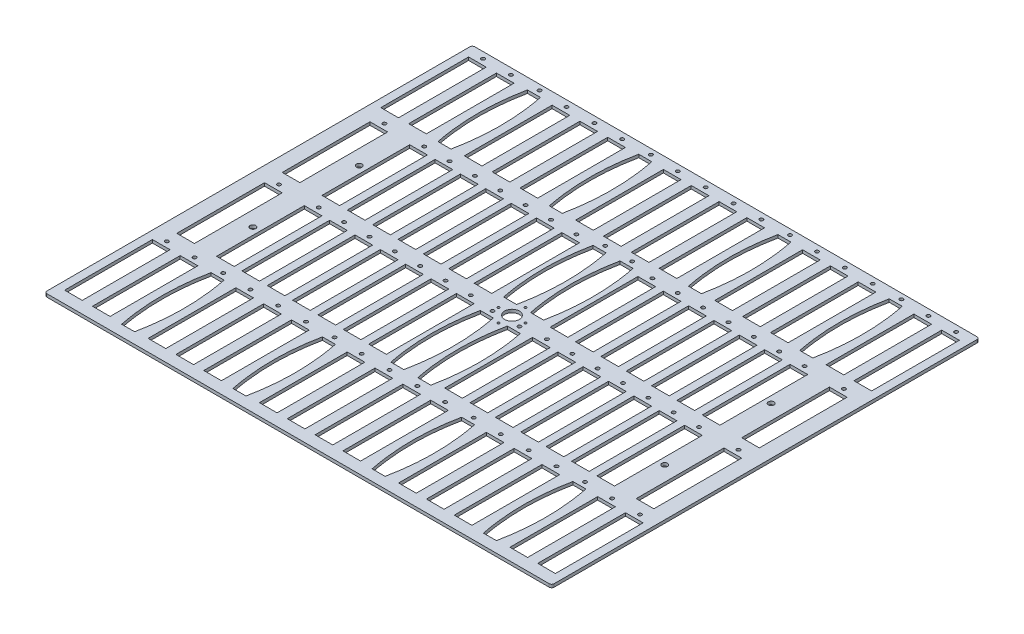
from build123d import *

# Parameters (mm, degrees)
SKETCH1_W                  = 525.4625
SKETCH1_H                  = 443.27572
BOSS_EXTRUDE1_DEPTH        = 3.175
SKETCH2_R                  = 7.62
CUT_EXTRUDE1_DEPTH         = 344.745736464
F_2_CLEARANCE_HOLE1_D      = 2.4384
F_1_0_228_DIAMETER_HOLE1_D = 5.7912
SKETCH5_R                  = 1.8288
SKETCH5_W                  = 18.288
SKETCH5_H                  = 90.932
CUT_EXTRUDE3_DEPTH         = 3.175
F_6_CLEARANCE_HOLE2_D      = 3.6576
SKETCH11_R                 = 1.8288
SKETCH11_W                 = 18.288
SKETCH11_H                 = 90.932
CUT_EXTRUDE5_DEPTH         = 3.175
SKETCH12_R                 = 1.8288
SKETCH12_W                 = 18.288
SKETCH12_H                 = 90.932
CUT_EXTRUDE6_DEPTH         = 3.175
FILLET1_R                  = 2.54


with BuildPart() as part:
    # Sketch1 → Boss-Extrude1 (new body)
    with BuildSketch(Plane(origin=(0, 0, 0), x_dir=(1, 0, 0), z_dir=(0, 1, 0))):
        Rectangle(SKETCH1_W, SKETCH1_H)
    extrude(amount=BOSS_EXTRUDE1_DEPTH)

    # Sketch2 → Cut-Extrude1 (cut, through all)
    with BuildSketch(Plane(origin=(0, 3.175, 0), x_dir=(1, 0, 0), z_dir=(0, 1, 0))):
        Circle(SKETCH2_R)
    extrude(amount=-CUT_EXTRUDE1_DEPTH, mode=Mode.SUBTRACT)

    # #2 Clearance Hole1 (through all)
    with Locations(Plane(origin=(0, 3.175, 0), x_dir=(1, 0, 0), z_dir=(0, 1, 0))):
        with Locations((0, 0), (0, 13.97), (13.97, 0), (0, -13.97), (-13.97, 0)):
            Hole(F_2_CLEARANCE_HOLE1_D / 2)

    # #1 (0.228) Diameter Hole1 (through all)
    with Locations(Plane(origin=(0, 3.175, 0), x_dir=(1, 0, 0), z_dir=(0, 1, 0))):
        with Locations((213.36, 55.1010709), (-213.36, -55.1010709), (-213.36, 55.1010709), (213.36, -55.1010709)):
            Hole(F_1_0_228_DIAMETER_HOLE1_D / 2)

    # Sketch5 → Cut-Extrude3 (cut)
    with BuildSketch(Plane(origin=(0, 3.175, 0), x_dir=(1, 0, 0), z_dir=(0, 1, 0))):
        with Locations((-245.13667, 215.13546)):
            Circle(SKETCH5_R)
        with Locations((-245.13667, -112.52708)):
            Circle(SKETCH5_R)
        with Locations((-216.29751, 215.13546)):
            Circle(SKETCH5_R)
        with Locations((-216.29751, -112.52708)):
            Circle(SKETCH5_R)
        with Locations((-187.457503333, 216.02446)):
            Circle(SKETCH5_R)
        with Locations((-72.09917, 216.02446)):
            Circle(SKETCH5_R)
        with Locations((-158.61919, 215.13546)):
            Circle(SKETCH5_R)
        with Locations((-158.61919, -112.52708)):
            Circle(SKETCH5_R)
        with Locations((-129.78003, 215.13546)):
            Circle(SKETCH5_R)
        with Locations((-129.78003, -112.52708)):
            Circle(SKETCH5_R)
        with Locations((-100.94087, 215.13546)):
            Circle(SKETCH5_R)
        with Locations((-100.94087, -112.52708)):
            Circle(SKETCH5_R)
        with Locations((72.098746667, 216.02446)):
            Circle(SKETCH5_R)
        with Locations((187.45708, 216.02446)):
            Circle(SKETCH5_R)
        with Locations((-43.26255, 215.13546)):
            Circle(SKETCH5_R)
        with Locations((-43.26255, -112.52708)):
            Circle(SKETCH5_R)
        with Locations((-14.42339, 215.13546)):
            Circle(SKETCH5_R)
        with Locations((-14.42339, -112.52708)):
            Circle(SKETCH5_R)
        with Locations((14.41577, 215.13546)):
            Circle(SKETCH5_R)
        with Locations((14.41577, -112.52708)):
            Circle(SKETCH5_R)
        with Locations((43.25493, 215.13546)):
            Circle(SKETCH5_R)
        with Locations((43.25493, -112.52708)):
            Circle(SKETCH5_R)
        with Locations((-187.457503333, -111.78794)):
            Circle(SKETCH5_R)
        with Locations((-72.09917, -111.78794)):
            Circle(SKETCH5_R)
        with Locations((100.93325, 215.13546)):
            Circle(SKETCH5_R)
        with Locations((100.93325, -112.52708)):
            Circle(SKETCH5_R)
        with Locations((129.77241, 215.13546)):
            Circle(SKETCH5_R)
        with Locations((129.77241, -112.52708)):
            Circle(SKETCH5_R)
        with Locations((158.61157, 215.13546)):
            Circle(SKETCH5_R)
        with Locations((158.61157, -112.52708)):
            Circle(SKETCH5_R)
        with Locations((187.45708, -111.78794)):
            Circle(SKETCH5_R)
        with Locations((72.098746667, -111.78794)):
            Circle(SKETCH5_R)
        with Locations((216.28989, 215.13546)):
            Circle(SKETCH5_R)
        with Locations((216.28989, -112.52708)):
            Circle(SKETCH5_R)
        with Locations((245.12905, 215.13546)):
            Circle(SKETCH5_R)
        with Locations((245.12905, -112.52708)):
            Circle(SKETCH5_R)
        with Locations((-216.29751, 163.82746)):
            Rectangle(SKETCH5_W, SKETCH5_H)
        with Locations((-245.13667, 163.82746)):
            Rectangle(SKETCH5_W, SKETCH5_H)
        with Locations((-245.13667, -163.83508)):
            Rectangle(SKETCH5_W, SKETCH5_H)
        with Locations((-216.29751, -163.83508)):
            Rectangle(SKETCH5_W, SKETCH5_H)
        with BuildLine():
            Line((-194.188503333, 210.18246), (-180.726503333, 210.18246))
            add(Edge.make_bspline(
                [(-180.726503333, 210.18246), (-171.328503333, 163.82746), (-180.726503333, 117.47246)],
                knots=[0, 0, 0, 1, 1, 1], degree=2))
            Line((-180.726503333, 117.47246), (-194.188503333, 117.47246))
            add(Edge.make_bspline(
                [(-194.188503333, 210.18246), (-203.586503333, 163.82746), (-194.188503333, 117.47246)],
                knots=[0, 0, 0, 1, 1, 1], degree=2))
        make_face()
        with BuildLine():
            Line((-78.83017, 210.18246), (-65.36817, 210.18246))
            add(Edge.make_bspline(
                [(-65.36817, 210.18246), (-55.97017, 163.82746), (-65.36817, 117.47246)],
                knots=[0, 0, 0, 1, 1, 1], degree=2))
            Line((-65.36817, 117.47246), (-78.83017, 117.47246))
            add(Edge.make_bspline(
                [(-78.83017, 210.18246), (-88.22817, 163.82746), (-78.83017, 117.47246)],
                knots=[0, 0, 0, 1, 1, 1], degree=2))
        make_face()
        with Locations((-158.61919, 163.82746)):
            Rectangle(SKETCH5_W, SKETCH5_H)
        with Locations((-158.61919, -163.83508)):
            Rectangle(SKETCH5_W, SKETCH5_H)
        with Locations((-129.78003, 163.82746)):
            Rectangle(SKETCH5_W, SKETCH5_H)
        with Locations((-129.78003, -163.83508)):
            Rectangle(SKETCH5_W, SKETCH5_H)
        with Locations((-100.94087, 163.82746)):
            Rectangle(SKETCH5_W, SKETCH5_H)
        with Locations((-100.94087, -163.83508)):
            Rectangle(SKETCH5_W, SKETCH5_H)
        with BuildLine():
            Line((65.367746667, 210.18246), (78.829746667, 210.18246))
            add(Edge.make_bspline(
                [(78.829746667, 210.18246), (88.227746667, 163.82746), (78.829746667, 117.47246)],
                knots=[0, 0, 0, 1, 1, 1], degree=2))
            Line((78.829746667, 117.47246), (65.367746667, 117.47246))
            add(Edge.make_bspline(
                [(65.367746667, 210.18246), (55.969746667, 163.82746), (65.367746667, 117.47246)],
                knots=[0, 0, 0, 1, 1, 1], degree=2))
        make_face()
        with BuildLine():
            Line((180.72608, 210.18246), (194.18808, 210.18246))
            add(Edge.make_bspline(
                [(194.18808, 210.18246), (203.58608, 163.82746), (194.18808, 117.47246)],
                knots=[0, 0, 0, 1, 1, 1], degree=2))
            Line((194.18808, 117.47246), (180.72608, 117.47246))
            add(Edge.make_bspline(
                [(180.72608, 210.18246), (171.32808, 163.82746), (180.72608, 117.47246)],
                knots=[0, 0, 0, 1, 1, 1], degree=2))
        make_face()
        with BuildLine():
            Line((-194.188503333, -117.62994), (-180.726503333, -117.62994))
            add(Edge.make_bspline(
                [(-180.726503333, -117.62994), (-171.328503333, -163.98494), (-180.726503333, -210.33994)],
                knots=[0, 0, 0, 1, 1, 1], degree=2))
            Line((-180.726503333, -210.33994), (-194.188503333, -210.33994))
            add(Edge.make_bspline(
                [(-194.188503333, -117.62994), (-203.586503333, -163.98494), (-194.188503333, -210.33994)],
                knots=[0, 0, 0, 1, 1, 1], degree=2))
        make_face()
        with BuildLine():
            Line((-78.83017, -117.62994), (-65.36817, -117.62994))
            add(Edge.make_bspline(
                [(-65.36817, -117.62994), (-55.97017, -163.98494), (-65.36817, -210.33994)],
                knots=[0, 0, 0, 1, 1, 1], degree=2))
            Line((-65.36817, -210.33994), (-78.83017, -210.33994))
            add(Edge.make_bspline(
                [(-78.83017, -117.62994), (-88.22817, -163.98494), (-78.83017, -210.33994)],
                knots=[0, 0, 0, 1, 1, 1], degree=2))
        make_face()
        with Locations((-43.26255, 163.82746)):
            Rectangle(SKETCH5_W, SKETCH5_H)
        with Locations((-43.26255, -163.83508)):
            Rectangle(SKETCH5_W, SKETCH5_H)
        with Locations((-14.42339, 163.82746)):
            Rectangle(SKETCH5_W, SKETCH5_H)
        with Locations((-14.42339, -163.83508)):
            Rectangle(SKETCH5_W, SKETCH5_H)
        with Locations((14.41577, 163.82746)):
            Rectangle(SKETCH5_W, SKETCH5_H)
        with Locations((14.41577, -163.83508)):
            Rectangle(SKETCH5_W, SKETCH5_H)
        with Locations((43.25493, 163.82746)):
            Rectangle(SKETCH5_W, SKETCH5_H)
        with Locations((43.25493, -163.83508)):
            Rectangle(SKETCH5_W, SKETCH5_H)
        with BuildLine():
            Line((180.72608, -117.62994), (194.18808, -117.62994))
            add(Edge.make_bspline(
                [(194.18808, -117.62994), (203.58608, -163.98494), (194.18808, -210.33994)],
                knots=[0, 0, 0, 1, 1, 1], degree=2))
            Line((194.18808, -210.33994), (180.72608, -210.33994))
            add(Edge.make_bspline(
                [(180.72608, -117.62994), (171.32808, -163.98494), (180.72608, -210.33994)],
                knots=[0, 0, 0, 1, 1, 1], degree=2))
        make_face()
        with BuildLine():
            Line((65.367746667, -210.33994), (78.829746667, -210.33994))
            add(Edge.make_bspline(
                [(78.829746667, -117.62994), (88.227746667, -163.98494), (78.829746667, -210.33994)],
                knots=[0, 0, 0, 1, 1, 1], degree=2))
            Line((78.829746667, -117.62994), (65.367746667, -117.62994))
            add(Edge.make_bspline(
                [(65.367746667, -117.62994), (55.969746667, -163.98494), (65.367746667, -210.33994)],
                knots=[0, 0, 0, 1, 1, 1], degree=2))
        make_face()
        with Locations((100.93325, 163.82746)):
            Rectangle(SKETCH5_W, SKETCH5_H)
        with Locations((100.93325, -163.83508)):
            Rectangle(SKETCH5_W, SKETCH5_H)
        with Locations((129.77241, 163.82746)):
            Rectangle(SKETCH5_W, SKETCH5_H)
        with Locations((129.77241, -163.83508)):
            Rectangle(SKETCH5_W, SKETCH5_H)
        with Locations((158.61157, 163.82746)):
            Rectangle(SKETCH5_W, SKETCH5_H)
        with Locations((158.61157, -163.83508)):
            Rectangle(SKETCH5_W, SKETCH5_H)
        with Locations((216.28989, 163.82746)):
            Rectangle(SKETCH5_W, SKETCH5_H)
        with Locations((216.28989, -163.83508)):
            Rectangle(SKETCH5_W, SKETCH5_H)
        with Locations((245.12905, 163.82746)):
            Rectangle(SKETCH5_W, SKETCH5_H)
        with Locations((245.12905, -163.83508)):
            Rectangle(SKETCH5_W, SKETCH5_H)
    extrude(amount=-CUT_EXTRUDE3_DEPTH, mode=Mode.SUBTRACT)

    # #6 Clearance Hole2 (through all)
    with Locations(Plane(origin=(0, 3.175, 0), x_dir=(1, 0, 0), z_dir=(0, 1, 0))):
        with Locations((-245.13667, 215.13546)):
            Hole(F_6_CLEARANCE_HOLE2_D / 2)

    # Sketch11 → Cut-Extrude5 (cut)
    with BuildSketch(Plane(origin=(0, 3.175, 0), x_dir=(1, 0, 0), z_dir=(0, 1, 0))):
        with Locations((-238.04499, 105.86466)):
            Circle(SKETCH11_R)
        with Locations((238.04499, 105.86466)):
            Circle(SKETCH11_R)
        with Locations((238.04499, -3.40614)):
            Circle(SKETCH11_R)
        with Locations((-238.04499, -3.40614)):
            Circle(SKETCH11_R)
        with Locations((-238.04499, 54.55666)):
            Rectangle(SKETCH11_W, SKETCH11_H)
        with Locations((238.04499, 54.55666)):
            Rectangle(SKETCH11_W, SKETCH11_H)
        with Locations((238.04499, -54.71414)):
            Rectangle(SKETCH11_W, SKETCH11_H)
        with Locations((-238.04499, -54.71414)):
            Rectangle(SKETCH11_W, SKETCH11_H)
    extrude(amount=-CUT_EXTRUDE5_DEPTH, mode=Mode.SUBTRACT)

    # Sketch12 → Cut-Extrude6 (cut)
    with BuildSketch(Plane(origin=(0, 3.175, 0), x_dir=(1, 0, 0), z_dir=(0, 1, 0))):
        with Locations((-196.85, 105.86466)):
            Circle(SKETCH12_R)
        with Locations((-170.576875, 105.86466)):
            Circle(SKETCH12_R)
        with Locations((-144.30375, 105.86466)):
            Circle(SKETCH12_R)
        with Locations((-118.030625, 105.86466)):
            Circle(SKETCH12_R)
        with Locations((-91.7575, 105.86466)):
            Circle(SKETCH12_R)
        with Locations((-65.484375, 105.86466)):
            Circle(SKETCH12_R)
        with Locations((-39.21125, 105.86466)):
            Circle(SKETCH12_R)
        with Locations((-13.97, 110.56366)):
            Circle(SKETCH12_R)
        with Locations((13.97, 110.56366)):
            Circle(SKETCH12_R)
        with Locations((39.608125, 105.86466)):
            Circle(SKETCH12_R)
        with Locations((65.88125, 105.86466)):
            Circle(SKETCH12_R)
        with Locations((92.154375, 105.86466)):
            Circle(SKETCH12_R)
        with Locations((118.4275, 105.86466)):
            Circle(SKETCH12_R)
        with Locations((144.700625, 105.86466)):
            Circle(SKETCH12_R)
        with Locations((170.97375, 105.86466)):
            Circle(SKETCH12_R)
        with Locations((197.246875, 105.86466)):
            Circle(SKETCH12_R)
        with Locations((-170.576875, -3.40614)):
            Circle(SKETCH12_R)
        with Locations((-144.30375, -3.40614)):
            Circle(SKETCH12_R)
        with Locations((-118.030625, -3.40614)):
            Circle(SKETCH12_R)
        with Locations((-91.7575, -3.40614)):
            Circle(SKETCH12_R)
        with Locations((-65.484375, -3.40614)):
            Circle(SKETCH12_R)
        with Locations((-39.21125, -3.40614)):
            Circle(SKETCH12_R)
        with Locations((13.97, -6.27634)):
            Circle(SKETCH12_R)
        with Locations((-13.97, -6.27634)):
            Circle(SKETCH12_R)
        with Locations((39.608125, -3.40614)):
            Circle(SKETCH12_R)
        with Locations((65.88125, -3.40614)):
            Circle(SKETCH12_R)
        with Locations((92.154375, -3.40614)):
            Circle(SKETCH12_R)
        with Locations((118.4275, -3.40614)):
            Circle(SKETCH12_R)
        with Locations((144.700625, -3.40614)):
            Circle(SKETCH12_R)
        with Locations((170.97375, -3.40614)):
            Circle(SKETCH12_R)
        with Locations((197.246875, -3.40614)):
            Circle(SKETCH12_R)
        with Locations((-196.85, -3.40614)):
            Circle(SKETCH12_R)
        with Locations((-196.85, 54.55666)):
            Rectangle(SKETCH12_W, SKETCH12_H)
        with Locations((-170.576875, 54.55666)):
            Rectangle(SKETCH12_W, SKETCH12_H)
        with Locations((-144.30375, 54.55666)):
            Rectangle(SKETCH12_W, SKETCH12_H)
        with Locations((-118.030625, 54.55666)):
            Rectangle(SKETCH12_W, SKETCH12_H)
        with Locations((-91.7575, 54.55666)):
            Rectangle(SKETCH12_W, SKETCH12_H)
        with Locations((-65.484375, 54.55666)):
            Rectangle(SKETCH12_W, SKETCH12_H)
        with Locations((-39.21125, 54.55666)):
            Rectangle(SKETCH12_W, SKETCH12_H)
        with BuildLine():
            Line((-7.239, 104.72166), (-20.701, 104.72166))
            add(Edge.make_bspline(
                [(-20.701, 104.72166), (-30.099, 58.36666), (-20.701, 12.01166)],
                knots=[0, 0, 0, 1, 1, 1], degree=2))
            Line((-20.701, 12.01166), (-7.239, 12.01166))
            add(Edge.make_bspline(
                [(-7.239, 104.72166), (2.159, 58.36666), (-7.239, 12.01166)],
                knots=[0, 0, 0, 1, 1, 1], degree=2))
        make_face()
        with Locations((39.608125, 54.55666)):
            Rectangle(SKETCH12_W, SKETCH12_H)
        with Locations((65.88125, 54.55666)):
            Rectangle(SKETCH12_W, SKETCH12_H)
        with Locations((92.154375, 54.55666)):
            Rectangle(SKETCH12_W, SKETCH12_H)
        with Locations((118.4275, 54.55666)):
            Rectangle(SKETCH12_W, SKETCH12_H)
        with Locations((144.700625, 54.55666)):
            Rectangle(SKETCH12_W, SKETCH12_H)
        with Locations((170.97375, 54.55666)):
            Rectangle(SKETCH12_W, SKETCH12_H)
        with Locations((197.246875, 54.55666)):
            Rectangle(SKETCH12_W, SKETCH12_H)
        with Locations((-170.576875, -54.71414)):
            Rectangle(SKETCH12_W, SKETCH12_H)
        with Locations((-144.30375, -54.71414)):
            Rectangle(SKETCH12_W, SKETCH12_H)
        with Locations((-118.030625, -54.71414)):
            Rectangle(SKETCH12_W, SKETCH12_H)
        with Locations((-91.7575, -54.71414)):
            Rectangle(SKETCH12_W, SKETCH12_H)
        with Locations((-65.484375, -54.71414)):
            Rectangle(SKETCH12_W, SKETCH12_H)
        with Locations((-39.21125, -54.71414)):
            Rectangle(SKETCH12_W, SKETCH12_H)
        with BuildLine():
            Line((7.239, 12.01166), (20.701, 12.01166))
            add(Edge.make_bspline(
                [(20.701, 104.72166), (30.099, 58.36666), (20.701, 12.01166)],
                knots=[0, 0, 0, 1, 1, 1], degree=2))
            Line((20.701, 104.72166), (7.239, 104.72166))
            add(Edge.make_bspline(
                [(7.239, 104.72166), (-2.159, 58.36666), (7.239, 12.01166)],
                knots=[0, 0, 0, 1, 1, 1], degree=2))
        make_face()
        with Locations((39.608125, -54.71414)):
            Rectangle(SKETCH12_W, SKETCH12_H)
        with Locations((65.88125, -54.71414)):
            Rectangle(SKETCH12_W, SKETCH12_H)
        with Locations((92.154375, -54.71414)):
            Rectangle(SKETCH12_W, SKETCH12_H)
        with Locations((118.4275, -54.71414)):
            Rectangle(SKETCH12_W, SKETCH12_H)
        with Locations((144.700625, -54.71414)):
            Rectangle(SKETCH12_W, SKETCH12_H)
        with Locations((170.97375, -54.71414)):
            Rectangle(SKETCH12_W, SKETCH12_H)
        with Locations((197.246875, -54.71414)):
            Rectangle(SKETCH12_W, SKETCH12_H)
        with Locations((-196.85, -54.71414)):
            Rectangle(SKETCH12_W, SKETCH12_H)
        with BuildLine():
            Line((-7.239, -12.11834), (-20.701, -12.11834))
            add(Edge.make_bspline(
                [(-20.701, -12.11834), (-30.099, -58.47334), (-20.701, -104.82834)],
                knots=[0, 0, 0, 1, 1, 1], degree=2))
            Line((-20.701, -104.82834), (-7.239, -104.82834))
            add(Edge.make_bspline(
                [(-7.239, -12.11834), (2.159, -58.47334), (-7.239, -104.82834)],
                knots=[0, 0, 0, 1, 1, 1], degree=2))
        make_face()
        with BuildLine():
            Line((7.239, -12.11834), (20.701, -12.11834))
            add(Edge.make_bspline(
                [(20.701, -12.11834), (30.099, -58.47334), (20.701, -104.82834)],
                knots=[0, 0, 0, 1, 1, 1], degree=2))
            Line((20.701, -104.82834), (7.239, -104.82834))
            add(Edge.make_bspline(
                [(7.239, -12.11834), (-2.159, -58.47334), (7.239, -104.82834)],
                knots=[0, 0, 0, 1, 1, 1], degree=2))
        make_face()
    extrude(amount=-CUT_EXTRUDE6_DEPTH, mode=Mode.SUBTRACT)

    # Fillet1
    fillet1_edges = [part.edges().sort_by_distance(p)[0] for p in [
        (-262.73125, 1.5875, -221.63786),
        (-262.73125, 1.5875, 221.63786),
        (262.73125, 1.5875, 221.63786),
        (262.73125, 1.5875, -221.63786),
    ]]
    fillet(fillet1_edges, radius=FILLET1_R)


solid = part.part
